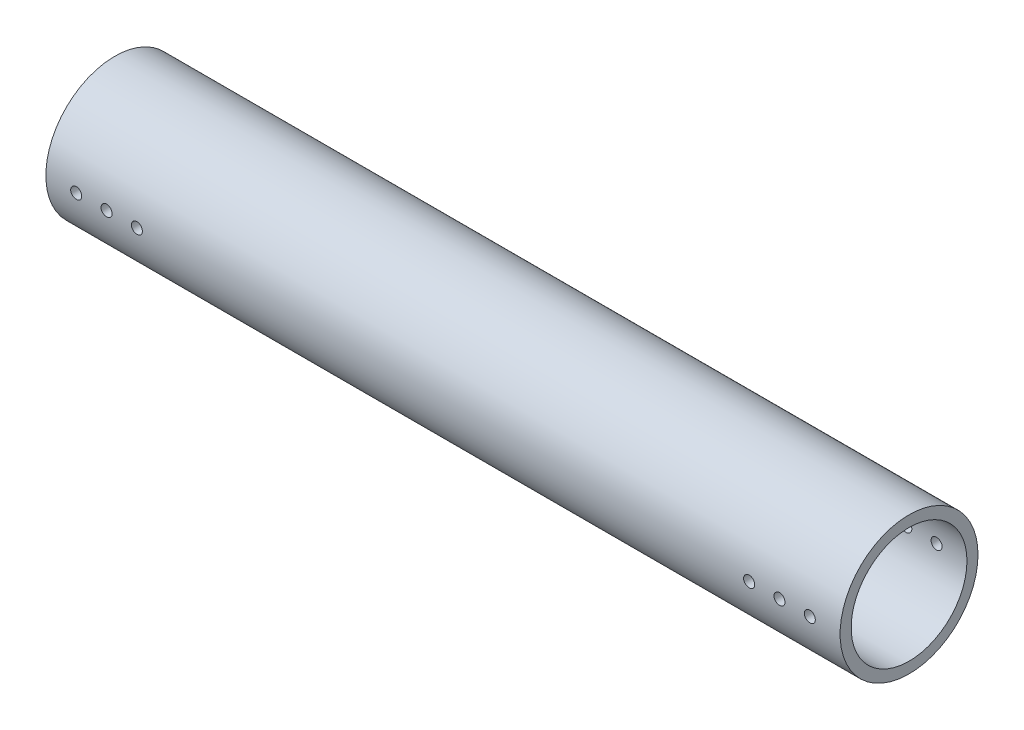
from build123d import *

# Parameters (mm, degrees)
SKETCH_2_R               = 25
SKETCH_2_R_2             = 21
EXTRUDE_2_DEPTH          = 288
CUT_EXTRUDE_2_DEPTH      = 10
CUT_EXTRUDE_2_DEPTH_BACK = 294.375186408
SKETCH_4_R               = 2


with BuildPart() as part:
    # Эскиз2 → Бобышка-Вытянуть2 (new body)
    with BuildSketch(Plane(origin=(0, 0, 0), x_dir=(0, 0, -1), z_dir=(1, 0, 0))):
        Circle(SKETCH_2_R)
        Circle(SKETCH_2_R_2, mode=Mode.SUBTRACT)
    extrude(amount=EXTRUDE_2_DEPTH)

    # Эскиз4 → Вырез-Вытянуть2 (cut, two sides: drawn at the far end of the back side and taken through both)
    with BuildSketch(Plane.XY.offset(25).offset(-CUT_EXTRUDE_2_DEPTH_BACK)):
        with Locations((11, 0)):
            Circle(SKETCH_4_R)
        with Locations((277, 0)):
            Circle(SKETCH_4_R)
        with Locations((22, 0)):
            Circle(SKETCH_4_R)
        with Locations((33, 0)):
            Circle(SKETCH_4_R)
        with Locations((266, 0)):
            Circle(SKETCH_4_R)
        with Locations((255, 0)):
            Circle(SKETCH_4_R)
    extrude(amount=CUT_EXTRUDE_2_DEPTH + CUT_EXTRUDE_2_DEPTH_BACK, mode=Mode.SUBTRACT)


solid = part.part
